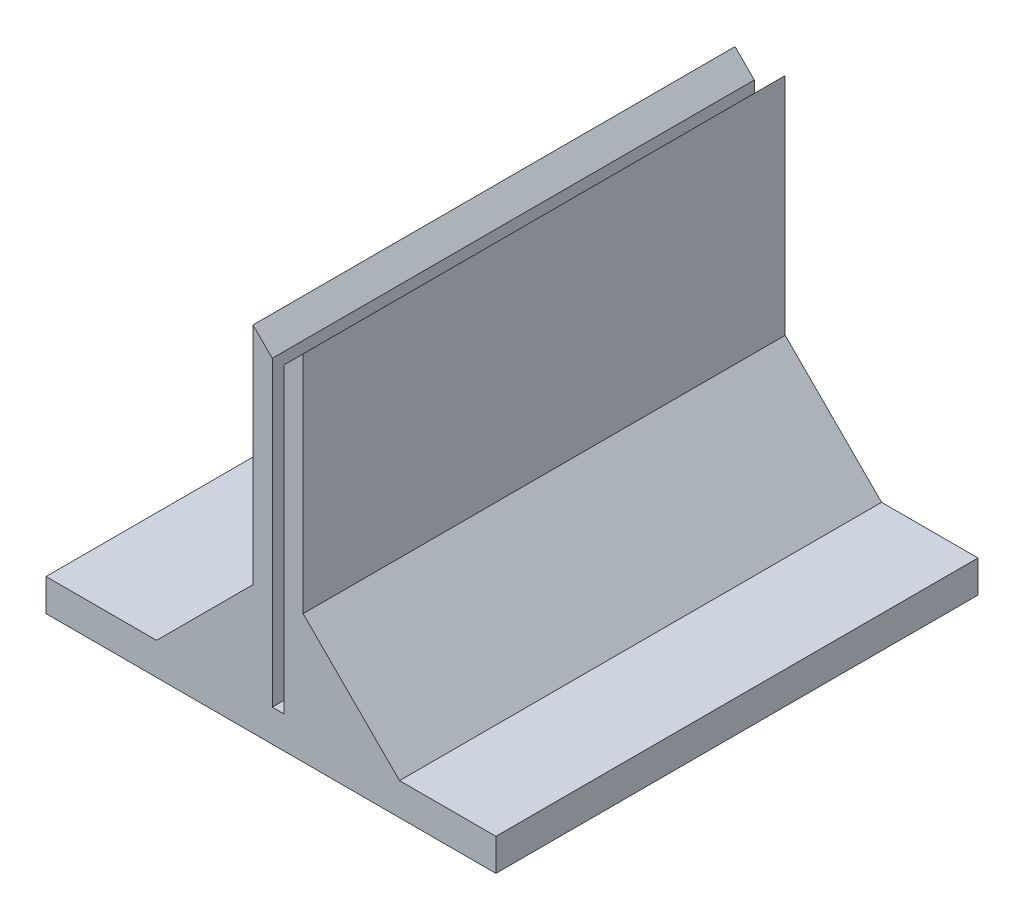
from build123d import *

# Parameters (mm, degrees)
EXTRUDE_1_DEPTH = 75
CHAMFER_1_SIZE  = 15
CHAMFER_2_SIZE  = 3


with BuildPart() as part:
    # 草图1 → 凸台-拉伸1 (new body)
    with BuildSketch(Plane.XY):
        Polygon((0, 0), (70, 0), (70, 5), (40, 5), (40, 55), (37, 55), (37, 5), (35.2, 5), (35.2, 55), (32.2, 55), (32.2, 5), (0, 5), align=None)
    extrude(amount=EXTRUDE_1_DEPTH)

    # 倒角1
    chamfer_1_edges = [part.edges().sort_by_distance(p)[0] for p in [
        (32.2, 5, 37.5),
        (40, 5, 37.5),
    ]]
    chamfer(chamfer_1_edges, length=CHAMFER_1_SIZE)

    # 倒角2
    chamfer_2_edges = [part.edges().sort_by_distance(p)[0] for p in [
        (37, 55, 37.5),
        (35.2, 55, 37.5),
    ]]
    chamfer(chamfer_2_edges, length=CHAMFER_2_SIZE - 0.0001)  # a hair under: the kernel refuses the full size


solid = part.part
